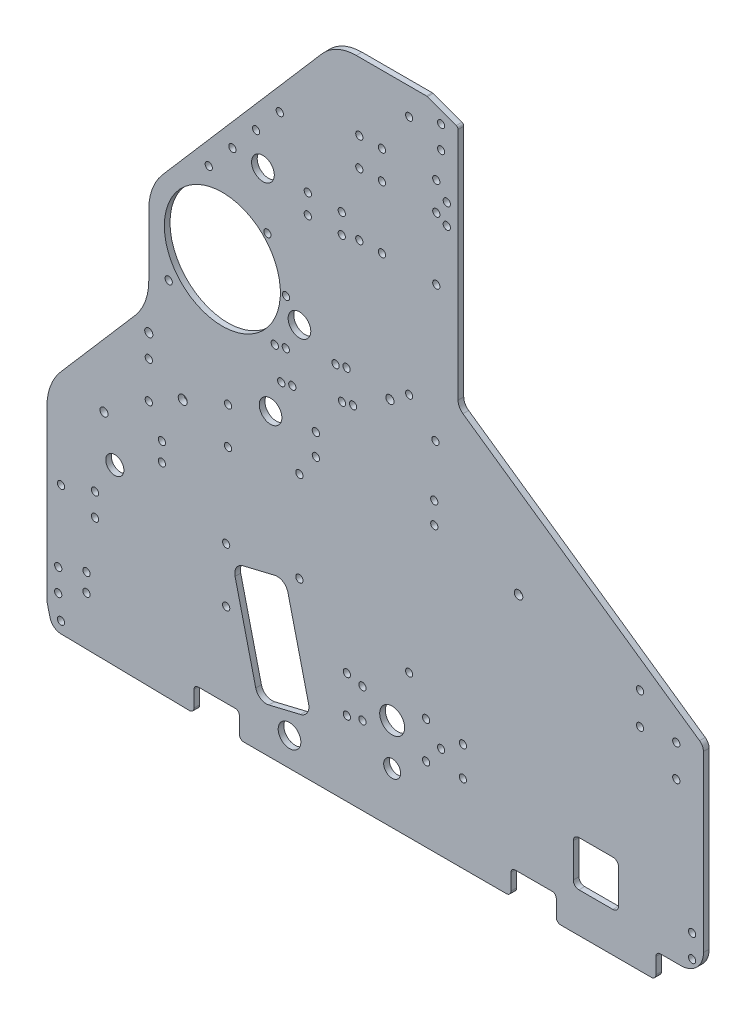
from build123d import *

# Parameters (mm, degrees)
SKETCH1_R           = 2.032
SKETCH1_R_2         = 5.08
SKETCH1_R_3         = 2.54
SKETCH1_R_4         = 6.35
SKETCH1_R_5         = 2
BOSS_EXTRUDE1_DEPTH = 3.175
FILLET1_R           = 2.286
FILLET2_R           = 6.35
SKETCH2_R           = 2.032
CUT_EXTRUDE1_DEPTH  = 505.524983177
FILLET3_R           = 1.5875
SKETCH3_R           = 6.35
SKETCH3_R_2         = 2.032
SKETCH3_R_3         = 2.286
CUT_EXTRUDE2_DEPTH  = 505.524983177
SKETCH4_R           = 2.032
SKETCH4_R_2         = 6.985
SKETCH4_R_3         = 4.7625
CUT_EXTRUDE3_DEPTH  = 505.524983177
SKETCH5_W           = 29.448186139
SKETCH5_H           = 14.946422423
SKETCH5_R           = 32.54375
SKETCH5_R_2         = 6.35
SKETCH5_R_3         = 2.39
CUT_EXTRUDE5_DEPTH  = 505.524983177
FILLET4_R           = 31.75
CUT_EXTRUDE6_DEPTH  = 505.524983177
FILLET5_R           = 25.4
SKETCH8_R           = 2.032000002
SKETCH8_R_2         = 2.031999999
SKETCH8_R_3         = 2.031999998
CUT_EXTRUDE7_DEPTH  = 505.524983177
SKETCH10_R          = 2.031999996
CUT_EXTRUDE8_DEPTH  = 505.524983177
SKETCH11_RX         = 2.032
SKETCH11_RY         = 2.031999502
CUT_EXTRUDE9_DEPTH  = 505.524983177
SKETCH12_R          = 2.032
CUT_EXTRUDE10_DEPTH = 505.524983319
SKETCH14_R          = 6.375981846
CUT_EXTRUDE11_DEPTH = 505.524983319
SKETCH15_R          = 2.286
CUT_EXTRUDE12_DEPTH = 505.524983319
FILLET6_R           = 12.7
FILLET7_R           = 5.08
FILLET8_R           = 2.54
SKETCH17_R          = 2.032
CUT_EXTRUDE13_DEPTH = 505.524983319


with BuildPart() as part:
    # Sketch1 → Boss-Extrude1 (new body)
    with BuildSketch(Plane.XY):
        with BuildLine():
            Line((7.829508682, -19.049081656), (82.55, -20.32))
            Line((82.55, -20.32), (82.55, -6.35))
            Line((82.55, -6.35), (107.95, -6.35))
            Line((107.95, -6.35), (107.95, -20.32))
            Line((107.95, -20.32), (260.35, -20.32))
            Line((260.35, -20.32), (260.35, -6.35))
            Line((260.35, -6.35), (285.75, -6.35))
            Line((285.75, -6.35), (285.75, -20.32))
            Line((285.75, -20.32), (368.3, -20.32))
            Line((368.3, -20.32), (368.3, 106.68))
            Line((368.3, 106.68), (230.66375, 202.565))
            Line((230.66375, 202.565), (230.66375, 338.455))
            Line((230.66375, 338.455), (213.19998, 344.805))
            Line((213.19998, 344.805), (203.2, 344.805))
            Line((203.2, 344.805), (161.925, 344.805))
            Line((161.925, 344.805), (52.720122664, 218.469945827))
            ThreePointArc((52.720122664, 218.469945827), (52.803835479, 218.142145922), (52.832, 217.805))
            ThreePointArc((52.832, 217.805), (52.095493096, 216.239521914), (50.419872403, 215.808871996))
            Line((50.419872403, 215.808871996), (0, 157.48))
            Line((0, 157.48), (0, 0))
            Line((0, 0), (0, -6.35))
            ThreePointArc((0, -6.35), (0.047577015, -7.125863724), (0.189595124, -7.890101219))
            Line((0.189595124, -7.890101219), (1.777095124, -14.240101219))
            ThreePointArc((1.777095124, -14.240101219), (3.987212552, -17.671692778), (7.829508682, -19.049081656))
        make_face()
        with Locations((7.9375, -12.7)):
            Circle(SKETCH1_R, mode=Mode.SUBTRACT)
        with Locations((6.35, 0)):
            Circle(SKETCH1_R, mode=Mode.SUBTRACT)
        with Locations((6.35, 12.7)):
            Circle(SKETCH1_R, mode=Mode.SUBTRACT)
        with Locations((38.1, 78.105)):
            Circle(SKETCH1_R_2, mode=Mode.SUBTRACT)
        with Locations((57.15, 118.58625)):
            Circle(SKETCH1_R, mode=Mode.SUBTRACT)
        with Locations((57.15, 139.22375)):
            Circle(SKETCH1_R, mode=Mode.SUBTRACT)
        with Locations((76.2, 128.905)):
            Circle(SKETCH1_R_3, mode=Mode.SUBTRACT)
        with Locations((101.6, 118.58625)):
            Circle(SKETCH1_R, mode=Mode.SUBTRACT)
        with Locations((101.6, 139.22375)):
            Circle(SKETCH1_R, mode=Mode.SUBTRACT)
        with Locations((125.468192568, 147.91106164)):
            Circle(SKETCH1_R_4, mode=Mode.SUBTRACT)
        with Locations((203.2, 59.805)):
            Circle(SKETCH1_R_5, mode=Mode.SUBTRACT)
        with Locations((361.95, 0)):
            Circle(SKETCH1_R, mode=Mode.SUBTRACT)
        with Locations((361.95, 12.7)):
            Circle(SKETCH1_R, mode=Mode.SUBTRACT)
        with Locations((353.06, 82.955052336)):
            Circle(SKETCH1_R, mode=Mode.SUBTRACT)
        with Locations((332.74, 98.195052336)):
            Circle(SKETCH1_R, mode=Mode.SUBTRACT)
        with Locations((332.74, 115.975052336)):
            Circle(SKETCH1_R, mode=Mode.SUBTRACT)
        with Locations((353.06, 100.735052336)):
            Circle(SKETCH1_R, mode=Mode.SUBTRACT)
        with Locations((68.326, 182.923674932)):
            Circle(SKETCH1_R, mode=Mode.SUBTRACT)
        with Locations((76.2, 217.805)):
            Circle(SKETCH1_R, mode=Mode.SUBTRACT)
        with Locations((90.779500502, 249.682)):
            Circle(SKETCH1_R, mode=Mode.SUBTRACT)
        with Locations((104.067838673, 265.054783374)):
            Circle(SKETCH1_R, mode=Mode.SUBTRACT)
        with Locations((117.356176844, 280.427566748)):
            Circle(SKETCH1_R, mode=Mode.SUBTRACT)
        with Locations((130.644515014, 295.800350122)):
            Circle(SKETCH1_R, mode=Mode.SUBTRACT)
        with Locations((203.2, 194.805)):
            Circle(SKETCH1_R_5, mode=Mode.SUBTRACT)
        with Locations((224.31375, 287.401)):
            Circle(SKETCH1_R, mode=Mode.SUBTRACT)
        with Locations((224.31375, 298.831)):
            Circle(SKETCH1_R, mode=Mode.SUBTRACT)
        with Locations((203.2, 329.805)):
            Circle(SKETCH1_R_5, mode=Mode.SUBTRACT)
        with Locations((221.138115, 322.58)):
            Circle(SKETCH1_R_5, mode=Mode.SUBTRACT)
        with Locations((221.138115, 335.28)):
            Circle(SKETCH1_R_5, mode=Mode.SUBTRACT)
    extrude(amount=BOSS_EXTRUDE1_DEPTH)

    # Fillet1
    fillet1_edges = [part.edges().sort_by_distance(p)[0] for p in [
        (285.75, -6.35, 1.5875),
        (107.95, -6.35, 1.5875),
        (260.35, -6.35, 1.5875),
        (82.55, -6.35, 1.5875),
    ]]
    fillet(fillet1_edges, radius=FILLET1_R)

    # Fillet2
    fillet2_edges = [part.edges().sort_by_distance(p)[0] for p in [
        (230.66375, 202.565, 1.5875),
    ]]
    fillet(fillet2_edges, radius=FILLET2_R)

    # Sketch2 → Cut-Extrude1 (cut, through all)
    with BuildSketch(Plane(origin=(0, 0, 0), x_dir=(-1, 0, 0), z_dir=(0, 0, -1))):
        with Locations((-100.552770272, 71.086035298)):
            Circle(SKETCH2_R)
        with Locations((-100.552770272, 40.606035298)):
            Circle(SKETCH2_R)
        with Locations((-22.225, 18.202541089)):
            Circle(SKETCH2_R)
        with Locations((-22.225, 8.042541089)):
            Circle(SKETCH2_R)
    extrude(amount=-CUT_EXTRUDE1_DEPTH, mode=Mode.SUBTRACT)

    # Fillet3
    fillet3_edges = [part.edges().sort_by_distance(p)[0] for p in [
        (230.66375, 338.455, 1.5875),
        (213.19998, 344.805, 1.5875),
    ]]
    fillet(fillet3_edges, radius=FILLET3_R)

    # Sketch3 → Cut-Extrude2 (cut, through all)
    with BuildSketch(Plane.XY.offset(3.175)):
        with BuildLine():
            Line((127.789350211, 69.359774106), (110.090750339, 65.117184968))
            ThreePointArc((110.090750339, 65.117184968), (106.287939856, 62.356288953), (105.55119507, 57.715047577))
            Line((105.55119507, 57.715047577), (117.160037875, 9.287010566))
            ThreePointArc((117.160037875, 9.287010566), (119.92093389, 5.484200083), (124.562175266, 4.747455297))
            Line((124.562175266, 4.747455297), (142.260775137, 8.990044434))
            ThreePointArc((142.260775137, 8.990044434), (146.063585621, 11.75094045), (146.800330407, 16.392181825))
            Line((146.800330407, 16.392181825), (135.191487602, 64.820218836))
            ThreePointArc((135.191487602, 64.820218836), (132.430591586, 68.62302932), (127.789350211, 69.359774106))
        make_face()
        with Locations((136.094563167, -4.324155877)):
            Circle(SKETCH3_R)
        with Locations((26.987500002, 46.953113935)):
            Circle(SKETCH3_R_2)
        with Locations((26.987500002, 59.653113935)):
            Circle(SKETCH3_R_2)
        with Locations((7.937500002, 53.303113935)):
            Circle(SKETCH3_R_2)
        with Locations((32.030600738, 100.810868776)):
            Circle(SKETCH3_R_3)
        with Locations((64.525942114, 102.94048958)):
            Circle(SKETCH3_R_2)
        with Locations((64.525942114, 92.525786339)):
            Circle(SKETCH3_R_2)
        with Locations((134.14375, 208.228121768)):
            Circle(SKETCH3_R_2)
        with Locations((123.681970341, 233.485092108)):
            Circle(SKETCH3_R_2)
    extrude(amount=-CUT_EXTRUDE2_DEPTH, mode=Mode.SUBTRACT)

    # Sketch4 → Cut-Extrude3 (cut, through all)
    with BuildSketch(Plane.XY.offset(3.175)):
        with Locations((168.275, 42.06875)):
            Circle(SKETCH4_R)
        with Locations((212.725, 42.06875)):
            Circle(SKETCH4_R)
        with Locations((212.725, 21.43125)):
            Circle(SKETCH4_R)
        with Locations((168.275, 21.43125)):
            Circle(SKETCH4_R)
        with Locations((193.675, 31.75)):
            Circle(SKETCH4_R_2)
        with Locations((177.00498, 40.0431)):
            Circle(SKETCH4_R)
        with Locations((177.00498, 23.4569)):
            Circle(SKETCH4_R)
        with Locations((193.675, 8.466666658)):
            Circle(SKETCH4_R_3)
        with Locations((221.138115, 31.75)):
            Circle(SKETCH4_R)
        with Locations((233.36123, 23.4569)):
            Circle(SKETCH4_R)
        with Locations((233.36123, 40.0431)):
            Circle(SKETCH4_R)
    extrude(amount=-CUT_EXTRUDE3_DEPTH, mode=Mode.SUBTRACT)

    # Sketch5 → Cut-Extrude5 (cut, through all)
    with BuildSketch(Plane(origin=(0, 0, 0), x_dir=(-1, 0, 0), z_dir=(0, 0, -1))):
        Polygon((0, 157.48), (-57.15, 223.594705882), (-57.15, 165.333696112), (0, 99.218990229), align=None)
        with Locations((-356.354093068, -13.823211213)):
            Rectangle(SKETCH5_W, SKETCH5_H)
        with Locations((-98.425, 208.228121768)):
            Circle(SKETCH5_R)
        with Locations((-141.675587431, 197.971943782)):
            Circle(SKETCH5_R_2)
        with Locations((-264.573581764, 128.332790468)):
            Circle(SKETCH5_R_3)
    extrude(amount=-CUT_EXTRUDE5_DEPTH, mode=Mode.SUBTRACT)

    # Fillet4
    fillet4_edges = [part.edges().sort_by_distance(p)[0] for p in [
        (0, 99.218990229, 1.5875),
        (57.15, 165.333696112, 1.5875),
        (57.15, 223.594705882, 1.5875),
    ]]
    fillet(fillet4_edges, radius=FILLET4_R)

    # Sketch6 → Cut-Extrude6 (cut, through all)
    with BuildSketch(Plane.XY.offset(3.175)):
        with BuildLine():
            Line((298.45, 27.305), (317.5, 27.305))
            ThreePointArc((317.5, 27.305), (319.74506403, 26.37506403), (320.675, 24.13))
            Line((320.675, 24.13), (320.675, 5.08))
            ThreePointArc((320.675, 5.08), (319.74506403, 2.83493597), (317.5, 1.905))
            Line((317.5, 1.905), (298.45, 1.905))
            ThreePointArc((298.45, 1.905), (296.20493597, 2.83493597), (295.275, 5.08))
            Line((295.275, 5.08), (295.275, 24.13))
            ThreePointArc((295.275, 24.13), (296.20493597, 26.37506403), (298.45, 27.305))
        make_face()
    extrude(amount=-CUT_EXTRUDE6_DEPTH, mode=Mode.SUBTRACT)

    # Fillet5
    fillet5_edges = [part.edges().sort_by_distance(p)[0] for p in [
        (161.925, 344.805, 1.5875),
    ]]
    fillet(fillet5_edges, radius=FILLET5_R)

    # Sketch8 → Cut-Extrude7 (cut, through all)
    with BuildSketch(Plane(origin=(0, 0, 0), x_dir=(-1, 0, 0), z_dir=(0, 0, -1))):
        with Locations((-218.44, 290.83)):
            Circle(SKETCH8_R)
        with Locations((-187.96, 290.83)):
            Circle(SKETCH8_R)
        with Locations((-187.96, 306.70500001)):
            Circle(SKETCH8_R_2)
        with Locations((-175.26, 290.83)):
            Circle(SKETCH8_R)
        with Locations((-187.96, 255.905)):
            Circle(SKETCH8_R)
        with Locations((-218.44, 306.70500001)):
            Circle(SKETCH8_R_3)
        with Locations((-175.26, 306.70500001)):
            Circle(SKETCH8_R_2)
        with Locations((-175.26, 255.905)):
            Circle(SKETCH8_R)
        with Locations((-218.44, 255.905)):
            Circle(SKETCH8_R)
    extrude(amount=-CUT_EXTRUDE7_DEPTH, mode=Mode.SUBTRACT)

    # Sketch10 → Cut-Extrude8 (cut, through all)
    with BuildSketch(Plane.XY.offset(3.175)):
        with Locations((141.642480004, 74.684371768)):
            Circle(SKETCH10_R)
        with Locations((141.642480004, 125.484371768)):
            Circle(SKETCH10_R)
    extrude(amount=-CUT_EXTRUDE8_DEPTH, mode=Mode.SUBTRACT)

    # Sketch11 → Cut-Extrude9 (cut, through all)
    with BuildSketch(Plane.XY.offset(3.175)):
        with Locations(Location((150.881424454, 138.43), (0, 0, 90))):
            Ellipse(SKETCH11_RX, SKETCH11_RY)
        with Locations(Location((150.881424454, 150.495), (0, 0, 90))):
            Ellipse(SKETCH11_RX, SKETCH11_RY)
        with Locations(Location((217.30240818, 150.495), (0, 0, 90))):
            Ellipse(SKETCH11_RX, SKETCH11_RY)
        with Locations(Location((217.30240818, 138.43), (0, 0, 90))):
            Ellipse(SKETCH11_RX, SKETCH11_RY)
    extrude(amount=-CUT_EXTRUDE9_DEPTH, mode=Mode.SUBTRACT)

    # Sketch12 → Cut-Extrude10 (cut, through all)
    with BuildSketch(Plane(origin=(0, 0, 0), x_dir=(-1, 0, 0), z_dir=(0, 0, -1))):
        with Locations((-165.4175, 264.63498)):
            Circle(SKETCH12_R)
        with Locations((-165.4175, 253.52248)):
            Circle(SKETCH12_R)
        with Locations((-146.3675, 253.52248)):
            Circle(SKETCH12_R)
        with Locations((-146.3675, 264.63498)):
            Circle(SKETCH12_R)
    extrude(amount=-CUT_EXTRUDE10_DEPTH, mode=Mode.SUBTRACT)

    # Sketch14 → Cut-Extrude11 (cut, through all)
    with BuildSketch(Plane(origin=(0, 0, 0), x_dir=(-1, 0, 0), z_dir=(0, 0, -1))):
        with Locations((-121.184716432, 263.688494682)):
            Circle(SKETCH14_R)
    extrude(amount=-CUT_EXTRUDE11_DEPTH, mode=Mode.SUBTRACT)

    # Sketch15 → Cut-Extrude12 (cut, through all)
    with BuildSketch(Plane.XY.offset(3.175)):
        with Locations((57.15, 151.92375)):
            Circle(SKETCH15_R)
        with Locations((192.439038956, 187.119947783)):
            Circle(SKETCH15_R)
        with BuildLine():
            ThreePointArc((163.873739892, 173.680575348), (163.573171662, 172.102507308), (164.512499361, 170.799317578))
            ThreePointArc((164.512499361, 170.799317578), (167.540838635, 172.982117899), (163.873739892, 173.680575348))
        make_face()
        with BuildLine():
            ThreePointArc((173.43975005, 172.778441408), (173.74031828, 174.356509448), (172.800990581, 175.659699178))
            ThreePointArc((172.800990581, 175.659699178), (169.772651307, 173.476898857), (173.43975005, 172.778441408))
        make_face()
        with BuildLine():
            ThreePointArc((169.158852977, 192.088320238), (166.130513704, 189.905519916), (169.797612447, 189.207062467))
            ThreePointArc((169.797612447, 189.207062467), (170.098180676, 190.785130507), (169.158852977, 192.088320238))
        make_face()
        with BuildLine():
            ThreePointArc((160.231602288, 190.109196408), (159.931034058, 188.531128368), (160.870361758, 187.227938637))
            ThreePointArc((160.870361758, 187.227938637), (163.898701031, 189.410738959), (160.231602288, 190.109196408))
        make_face()
        with BuildLine():
            ThreePointArc((129.776601843, 166.121421831), (129.476033613, 164.543353791), (130.415361312, 163.240164061))
            ThreePointArc((130.415361312, 163.240164061), (133.443700586, 165.422964382), (129.776601843, 166.121421831))
        make_face()
        with BuildLine():
            ThreePointArc((139.342612002, 165.219287891), (139.643180231, 166.797355931), (138.703852532, 168.100545661))
            ThreePointArc((138.703852532, 168.100545661), (135.675513258, 165.91774534), (139.342612002, 165.219287891))
        make_face()
        with BuildLine():
            ThreePointArc((135.700474398, 181.647908951), (136.001042628, 183.225976991), (135.061714929, 184.529166721))
            ThreePointArc((135.061714929, 184.529166721), (132.033375655, 182.3463664), (135.700474398, 181.647908951))
        make_face()
        with BuildLine():
            ThreePointArc((126.134464239, 182.550042891), (125.83389601, 180.971974851), (126.773223709, 179.668785121))
            ThreePointArc((126.773223709, 179.668785121), (129.801562983, 181.851585442), (126.134464239, 182.550042891))
        make_face()
    extrude(amount=-CUT_EXTRUDE12_DEPTH, mode=Mode.SUBTRACT)

    # Fillet6
    fillet6_edges = [part.edges().sort_by_distance(p)[0] for p in [
        (368.3, -6.350000001, 1.5875),
    ]]
    fillet(fillet6_edges, radius=FILLET6_R)

    # Fillet7
    fillet7_edges = [part.edges().sort_by_distance(p)[0] for p in [
        (368.3, 106.68, 1.5875),
    ]]
    fillet(fillet7_edges, radius=FILLET7_R)

    # Fillet8
    fillet8_edges = [part.edges().sort_by_distance(p)[0] for p in [
        (82.55, -20.32, 1.5875),
        (107.95, -20.32, 1.5875),
        (260.35, -20.32, 1.5875),
        (285.75, -20.32, 1.5875),
        (341.629999999, -20.32, 1.5875),
        (341.629999999, -6.350000001, 1.5875),
    ]]
    fillet(fillet8_edges, radius=FILLET8_R)

    # Sketch17 → Cut-Extrude13 (cut, through all)
    with BuildSketch(Plane.XY.offset(3.175)):
        with Locations((217.96375, 179.705)):
            Circle(SKETCH17_R)
    extrude(amount=-CUT_EXTRUDE13_DEPTH, mode=Mode.SUBTRACT)


solid = part.part
